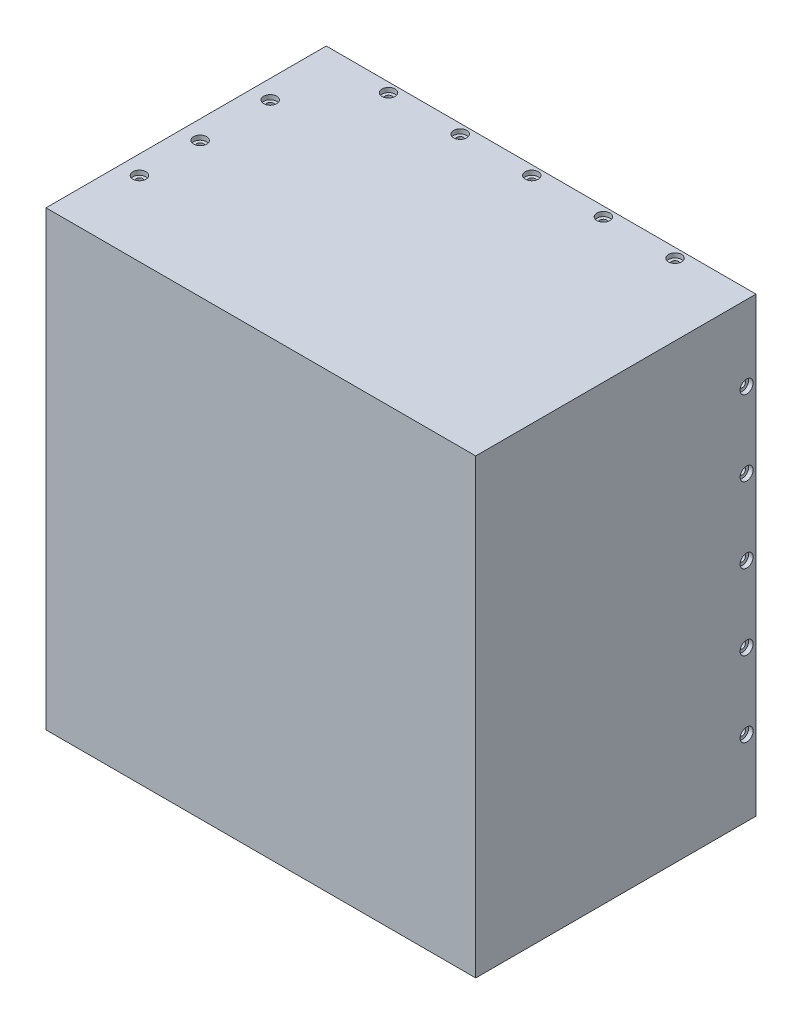
from build123d import *

# Parameters (mm, degrees)
SZKIC1_W                                          = 230
SZKIC1_H                                          = 242
DODANIE_WYCI_GNI_CIE1_DEPTH                       = 5
DODANIE_WYCI_GNI_CIE2_DEPTH                       = 145
SFAZOWANIE1_START                                 = -115
SFAZOWANIE1_DEPTH                                 = 116
SFAZOWANIE2_SIZE                                  = 10
SFAZOWANIE3_START                                 = -100
SFAZOWANIE3_DEPTH                                 = 210
POG_BIENIE_WALCOWE_POD_M3_RUB_Z_BEM_S_D           = 3.6
POG_BIENIE_WALCOWE_POD_M3_RUB_Z_BEM_S_DEPTH       = 6.7
POG_BIENIE_WALCOWE_POD_M3_RUB_Z_BEM_S_CBORE_D     = 7
POG_BIENIE_WALCOWE_POD_M3_RUB_Z_BEM_S_CBORE_DEPTH = 2.4
POG_BIENIE_WALCOWE_POD_M3_RUB_Z_BEM_S_TIP         = 1.081549114
POG_BIENIE_WALCOWE_POD_M3_RUB_Z_B_2_D             = 3.6
POG_BIENIE_WALCOWE_POD_M3_RUB_Z_B_2_DEPTH         = 6.7
POG_BIENIE_WALCOWE_POD_M3_RUB_Z_B_2_CBORE_D       = 7
POG_BIENIE_WALCOWE_POD_M3_RUB_Z_B_2_CBORE_DEPTH   = 2.4
POG_BIENIE_WALCOWE_POD_M3_RUB_Z_B_2_TIP           = 1.081549114
POG_BIENIE_WALCOWE_POD_M3_RUB_Z_B_3_D             = 3.6
POG_BIENIE_WALCOWE_POD_M3_RUB_Z_B_3_DEPTH         = 6.7
POG_BIENIE_WALCOWE_POD_M3_RUB_Z_B_3_CBORE_D       = 7
POG_BIENIE_WALCOWE_POD_M3_RUB_Z_B_3_CBORE_DEPTH   = 2.4
POG_BIENIE_WALCOWE_POD_M3_RUB_Z_B_3_TIP           = 1.081549114
SZKIC13_W                                         = 10
SZKIC13_H                                         = 7
DODANIE_WYCI_GNI_CIE3_DEPTH                       = 115
OTWORY_USTALAJ_CE_4_0MM1_D                        = 4
OTWORY_USTALAJ_CE_4_0MM1_DEPTH                    = 6.7
SFAZOWANIE4_SIZE                                  = 10


with BuildPart() as part:
    # Szkic1 → Dodanie-wyciągnięcie1 (new body)
    with BuildSketch(Plane.XY):
        Rectangle(SZKIC1_W, SZKIC1_H)
    extrude(amount=DODANIE_WYCI_GNI_CIE1_DEPTH)

    # Szkic6 → Dodanie-wyciągnięcie2 (add)
    with BuildSketch(Plane(origin=(0, 0, 0), x_dir=(-1, 0, 0), z_dir=(0, 0, -1))):
        Polygon((-115, 121), (-115, -121), (-110, -121), (-110, -116), (-110, 116), (110, 116), (115, 116), (115, 121), align=None)
    extrude(amount=DODANIE_WYCI_GNI_CIE2_DEPTH)

    # Sfazowanie1: read off the stored shape, not the designer's step
    # Sfazowanie1 outline → Sfazowanie1 (add)
    with BuildSketch(Plane.XY.offset(SFAZOWANIE1_START)):
        Polygon((110, 116), (100, 116), (110, 106), align=None)
    extrude(amount=SFAZOWANIE1_DEPTH)

    # Sfazowanie2
    sfazowanie2_edges = [part.edges().sort_by_distance(p)[0] for p in [
        (110, -7.5, 0),
        (105, 111, 0),
    ]]
    chamfer(sfazowanie2_edges, length=SFAZOWANIE2_SIZE)

    # Sfazowanie3: read off the stored shape, not the designer's step
    # Sfazowanie3 outline → Sfazowanie3 (add)
    with BuildSketch(Plane.YZ.offset(SFAZOWANIE3_START)):
        Polygon((106, 0), (116, -10), (116, 0), align=None)
    extrude(amount=SFAZOWANIE3_DEPTH)

    # Pog_bienie walcowe pod M3 _rub_ z _bem s
    with Locations(Plane(origin=(0, 121, 0), x_dir=(1, 0, 0), z_dir=(0, 1, 0))):
        with Locations((-76.666666667, 140), (-38.333333337, 140), (-7e-09, 140), (38.333333323, 140), (76.666666653, 140)):
            CounterBoreHole(POG_BIENIE_WALCOWE_POD_M3_RUB_Z_BEM_S_D / 2, POG_BIENIE_WALCOWE_POD_M3_RUB_Z_BEM_S_CBORE_D / 2, POG_BIENIE_WALCOWE_POD_M3_RUB_Z_BEM_S_CBORE_DEPTH, depth=POG_BIENIE_WALCOWE_POD_M3_RUB_Z_BEM_S_DEPTH)
            with Locations((0, 0, -(POG_BIENIE_WALCOWE_POD_M3_RUB_Z_BEM_S_DEPTH + POG_BIENIE_WALCOWE_POD_M3_RUB_Z_BEM_S_TIP / 2))):  # 118° drill point
                Cone(0, POG_BIENIE_WALCOWE_POD_M3_RUB_Z_BEM_S_D / 2, POG_BIENIE_WALCOWE_POD_M3_RUB_Z_BEM_S_TIP, mode=Mode.SUBTRACT)

    # Pog_bienie walcowe pod M3 _rub_ z _b 2
    with Locations(Plane(origin=(115, 0, 0), x_dir=(0, 0, -1), z_dir=(1, 0, 0))):
        with Locations((140, 80.666666667), (140, 40.333333337), (140, 7e-09), (140, -40.333333323), (140, -80.666666653)):
            CounterBoreHole(POG_BIENIE_WALCOWE_POD_M3_RUB_Z_B_2_D / 2, POG_BIENIE_WALCOWE_POD_M3_RUB_Z_B_2_CBORE_D / 2, POG_BIENIE_WALCOWE_POD_M3_RUB_Z_B_2_CBORE_DEPTH, depth=POG_BIENIE_WALCOWE_POD_M3_RUB_Z_B_2_DEPTH)
            with Locations((0, 0, -(POG_BIENIE_WALCOWE_POD_M3_RUB_Z_B_2_DEPTH + POG_BIENIE_WALCOWE_POD_M3_RUB_Z_B_2_TIP / 2))):  # 118° drill point
                Cone(0, POG_BIENIE_WALCOWE_POD_M3_RUB_Z_B_2_D / 2, POG_BIENIE_WALCOWE_POD_M3_RUB_Z_B_2_TIP, mode=Mode.SUBTRACT)

    # Pog_bienie walcowe pod M3 _rub_ z _b 3
    with Locations(Plane(origin=(0, 121, 0), x_dir=(1, 0, 0), z_dir=(0, 1, 0))):
        with Locations((-105, 105), (-105, 67.5), (-105, 35)):
            CounterBoreHole(POG_BIENIE_WALCOWE_POD_M3_RUB_Z_B_3_D / 2, POG_BIENIE_WALCOWE_POD_M3_RUB_Z_B_3_CBORE_D / 2, POG_BIENIE_WALCOWE_POD_M3_RUB_Z_B_3_CBORE_DEPTH, depth=POG_BIENIE_WALCOWE_POD_M3_RUB_Z_B_3_DEPTH)
            with Locations((0, 0, -(POG_BIENIE_WALCOWE_POD_M3_RUB_Z_B_3_DEPTH + POG_BIENIE_WALCOWE_POD_M3_RUB_Z_B_3_TIP / 2))):  # 118° drill point
                Cone(0, POG_BIENIE_WALCOWE_POD_M3_RUB_Z_B_3_D / 2, POG_BIENIE_WALCOWE_POD_M3_RUB_Z_B_3_TIP, mode=Mode.SUBTRACT)

    # Szkic13 → Dodanie-wyciągnięcie3 (add)
    with BuildSketch(Plane(origin=(0, 0, 0), x_dir=(-1, 0, 0), z_dir=(0, 0, -1))):
        with Locations((-105, -117.5)):
            Rectangle(SZKIC13_W, SZKIC13_H)
    extrude(amount=DODANIE_WYCI_GNI_CIE3_DEPTH)

    # Otwory ustalające Ø4.0mm1
    with Locations(Plane.XZ.offset(121)):
        with Locations((105, -105), (105, -67.5), (105, -35)):
            Hole(OTWORY_USTALAJ_CE_4_0MM1_D / 2, depth=OTWORY_USTALAJ_CE_4_0MM1_DEPTH)

    # Sfazowanie4
    sfazowanie4_edges = [part.edges().sort_by_distance(p)[0] for p in [
        (110, -117.5, -115),
        (110, -114, -62.5),
    ]]
    chamfer(sfazowanie4_edges, length=SFAZOWANIE4_SIZE - 0.0001)  # a hair under: the kernel refuses the full size


solid = part.part
